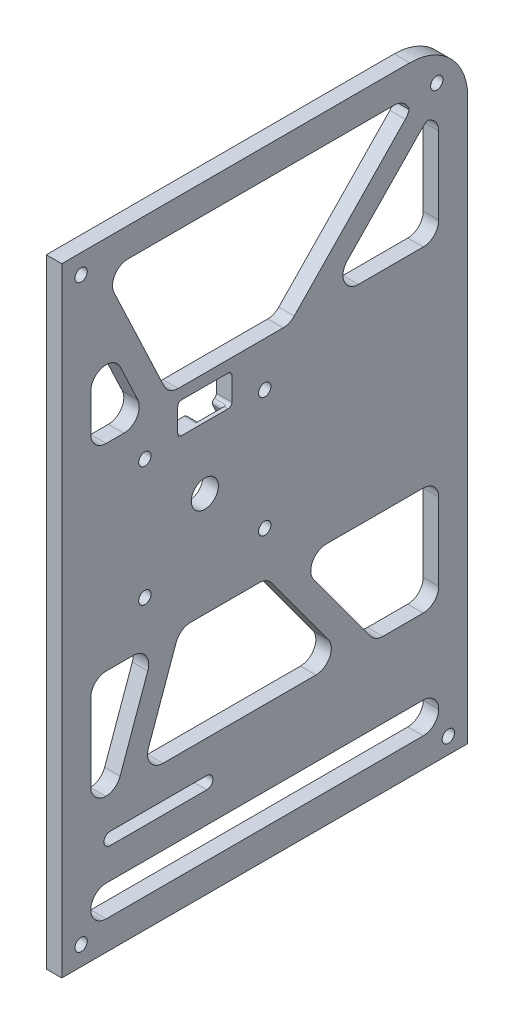
from build123d import *
from OCP.BRepFilletAPI import BRepFilletAPI_MakeChamfer

# Parameters (mm, degrees)
SKETCH2_R           = 1.6
SKETCH2_R_2         = 3.5
SKETCH2_W           = 14
SKETCH2_H           = 8
SKETCH2_W_2         = 90
BOSS_EXTRUDE1_DEPTH = 4
CHAMFER1_SIZE       = 1.5
FILLET2_R           = 1
FILLET3_R           = 4
CUT_EXTRUDE1_DEPTH  = 3
SKETCH4_W           = 5
SKETCH4_H           = 3
BOSS_EXTRUDE2_DEPTH = 1
CHAMFER2_SIZE       = 1.75
CHAMFER2_SIZE2      = 1.010362971
FILLET4_R           = 1


with BuildPart() as part:
    # Sketch2 → Boss-Extrude1 (new body)
    with BuildSketch(Plane(origin=(0, 0, 0), x_dir=(0, 0, -1), z_dir=(1, 0, 0))):
        with BuildLine():
            Line((0, 0), (105, 0))
            Line((105, 0), (105, 145))
            ThreePointArc((105, 145), (100.606601718, 155.606601718), (90, 160))
            Line((90, 160), (0, 160))
            Line((0, 160), (0, 0))
        make_face()
        with Locations((97, 152)):
            Circle(SKETCH2_R, mode=Mode.SUBTRACT)
        with Locations((52.5, 105.5)):
            Circle(SKETCH2_R, mode=Mode.SUBTRACT)
        with Locations((37, 90)):
            Circle(SKETCH2_R_2, mode=Mode.SUBTRACT)
        with Locations((52.5, 74.5)):
            Circle(SKETCH2_R, mode=Mode.SUBTRACT)
        with Locations((21.5, 74.5)):
            Circle(SKETCH2_R, mode=Mode.SUBTRACT)
        with Locations((21.5, 105.5)):
            Circle(SKETCH2_R, mode=Mode.SUBTRACT)
        with Locations((5, 5)):
            Circle(SKETCH2_R, mode=Mode.SUBTRACT)
        with Locations((100, 4.173161374)):
            Circle(SKETCH2_R, mode=Mode.SUBTRACT)
        with Locations((5, 155)):
            Circle(SKETCH2_R, mode=Mode.SUBTRACT)
        Polygon((10.817386923, 152.5), (90, 152.5), (90, 149.080597589), (58.954260398, 117), (27.573386923, 117), align=None, mode=Mode.SUBTRACT)
        with BuildLine():
            Line((12.5, 26.6), (37.5, 26.6))
            ThreePointArc((37.5, 26.6), (39.1, 25), (37.5, 23.4))
            Line((37.5, 23.4), (12.5, 23.4))
            ThreePointArc((12.5, 23.4), (10.9, 25), (12.5, 26.6))
        make_face(mode=Mode.SUBTRACT)
        Polygon((7.5, 35), (7.5, 63), (24.15943135, 63), (14.147310138, 35), align=None, mode=Mode.SUBTRACT)
        Polygon((97.5, 35), (97.5, 63), (60.520215048, 63), (81.053548381, 35), align=None, mode=Mode.SUBTRACT)
        with Locations((37, 110)):
            Rectangle(SKETCH2_W, SKETCH2_H, mode=Mode.SUBTRACT)
        Polygon((7.5, 145.471637874), (7.5, 114), (22.354613077, 114), align=None, mode=Mode.SUBTRACT)
        Polygon((97.5, 145), (97.5, 117), (67.303804118, 117), (94.400578312, 145), align=None, mode=Mode.SUBTRACT)
        with Locations((52.5, 11.5)):
            Rectangle(SKETCH2_W_2, SKETCH2_H, mode=Mode.SUBTRACT)
        Polygon((30.531477741, 63), (20.519356529, 35), (73.613118286, 35), (53.079784952, 63), align=None, mode=Mode.SUBTRACT)
    extrude(amount=BOSS_EXTRUDE1_DEPTH)

    # Chamfer1
    chamfer1_edges = [part.edges().sort_by_distance(p)[0] for p in [
        (0, 74.5, -50.9),
        (0, 105.5, -50.9),
        (0, 74.5, -19.9),
        (0, 105.5, -19.9),
        (0, 155, -3.4),
        (0, 152, -95.4),
        (0, 5, -3.4),
        (0, 4.173161374, -98.4),
    ]]
    chamfer(chamfer1_edges, length=CHAMFER1_SIZE)

    # Fillet2
    fillet2_edges = [part.edges().sort_by_distance(p)[0] for p in [
        (2, 114, -30),
        (2, 106, -30),
        (2, 106, -44),
        (2, 114, -44),
    ]]
    fillet(fillet2_edges, radius=FILLET2_R)

    # Fillet3
    # the kernel refuses this fillet: 4 mm, written as the material it adds along each edge
    with BuildSketch(Plane(origin=(0, 152.5, -90), x_dir=(0, 0, 1), z_dir=(1, 0, 0)), Plane(origin=(0, 117, -97.5), x_dir=(0, 1, 0), z_dir=(1, 0, 0)), Plane(origin=(0, 114, -7.5), x_dir=(0, 0, -1), z_dir=(1, 0, 0)), Plane(origin=(0, 63, -7.5), x_dir=(0, -1, 0), z_dir=(1, 0, 0)), Plane(origin=(0, 63, -97.5), x_dir=(0, 0, 1), z_dir=(1, 0, 0)), Plane(origin=(0, 7.5, -7.5), x_dir=(0, 0, -1), z_dir=(1, 0, 0)), Plane(origin=(0, 15.5, -7.5), x_dir=(0, -1, 0), z_dir=(1, 0, 0)), Plane(origin=(0, 15.5, -97.5), x_dir=(0, 0, 1), z_dir=(1, 0, 0))) as fillet3_piece_1:
        with BuildLine():
            CenterArc((FILLET3_R, FILLET3_R), FILLET3_R, 180, 90)
            Line((0, FILLET3_R), (0, 0))
            Line((0, 0), (FILLET3_R, 0))
        make_face()
    extrude(amount=4)
    with BuildSketch(Plane(origin=(0, 145, -97.5), x_dir=(0, -1, 0), z_dir=(1, 0, 0)), Plane(origin=(0, 35, -7.5), x_dir=(0, 1, 0), z_dir=(1, 0, 0)), Plane(origin=(0, 35, -97.5), x_dir=(0, 0, 1), z_dir=(1, 0, 0)), Plane(origin=(0, 7.5, -97.5), x_dir=(0, 0, 1), z_dir=(1, 0, 0))) as fillet3_piece_2:
        with BuildLine():
            CenterArc((FILLET3_R, -FILLET3_R), FILLET3_R, 90, 90)
            Line((0, -FILLET3_R), (0, 0))
            Line((0, 0), (FILLET3_R, 0))
        make_face()
    extrude(amount=4)
    with BuildSketch(Plane(origin=(0, 117, -67.303804118), x_dir=(0, 0, -1), z_dir=(1, 0, 0))) as fillet3_piece_3:
        with BuildLine():
            CenterArc((FILLET3_R * 2.35933255549, FILLET3_R), FILLET3_R, 135.939190946, 134.060809054)
            Line((FILLET3_R * 1.64073041373, FILLET3_R * 1.69542142752), (0, 0))
            Line((0, 0), (FILLET3_R * 2.35933255549, 0))
        make_face()
    extrude(amount=4)
    with BuildSketch(Plane(origin=(0, 145, -94.400578312), x_dir=(0, -0.7186021417665927, 0.6954214275160536), z_dir=(1, 0, 0)), Plane(origin=(0, 117, -58.954260398), x_dir=(0, 0.7186021417665911, -0.6954214275160554), z_dir=(1, 0, 0))) as fillet3_piece_4:
        with BuildLine():
            CenterArc((FILLET3_R * 0.423848684524, FILLET3_R), FILLET3_R, 224.060809054, 45.939190946)
            Line((-FILLET3_R * 0.294753457243, FILLET3_R * 0.304578572484), (0, 0))
            Line((0, 0), (FILLET3_R * 0.423848684524, 0))
        make_face()
    extrude(amount=4)
    with BuildSketch(Plane(origin=(0, 149.080597589, -90), x_dir=(0, 1, 0), z_dir=(1, 0, 0))) as fillet3_piece_5:
        with BuildLine():
            CenterArc((FILLET3_R * 0.404643640675, FILLET3_R), FILLET3_R, 225.939190946, 44.060809054)
            Line((-FILLET3_R * 0.290777786841, FILLET3_R * 0.281397858233), (0, 0))
            Line((0, 0), (FILLET3_R * 0.404643640675, 0))
        make_face()
    extrude(amount=4)
    with BuildSketch(Plane(origin=(0, 117, -27.573386923), x_dir=(0, 0, -1), z_dir=(1, 0, 0))) as fillet3_piece_6:
        with BuildLine():
            CenterArc((FILLET3_R * 0.633795641156, FILLET3_R), FILLET3_R, 205.2673105, 64.7326895)
            Line((-FILLET3_R * 0.270530585844, FILLET3_R * 0.573158020856), (0, 0))
            Line((0, 0), (FILLET3_R * 0.633795641156, 0))
        make_face()
    extrude(amount=4)
    with BuildSketch(Plane(origin=(0, 145.471637874, -7.5), x_dir=(0, -0.9043262270001705, -0.4268419791440808), z_dir=(1, 0, 0))) as fillet3_piece_7:
        with BuildLine():
            CenterArc((FILLET3_R * 4.46143144313, -FILLET3_R), FILLET3_R, 90, 154.7326895)
            Line((FILLET3_R * 4.03458946398, -FILLET3_R * 1.904326227), (0, 0))
            Line((0, 0), (FILLET3_R * 4.46143144313, 0))
        make_face()
    extrude(amount=4)
    with BuildSketch(Plane(origin=(0, 114, -22.354613077), x_dir=(0, 0.9043262270001708, 0.4268419791440801), z_dir=(1, 0, 0))) as fillet3_piece_8:
        with BuildLine():
            CenterArc((FILLET3_R * 1.57779564116, FILLET3_R), FILLET3_R, 154.7326895, 115.2673105)
            Line((FILLET3_R * 0.673469414156, FILLET3_R * 1.42684197914), (0, 0))
            Line((0, 0), (FILLET3_R * 1.57779564116, 0))
        make_face()
    extrude(amount=4)
    with BuildSketch(Plane(origin=(0, 63, -24.15943135), x_dir=(0, 0, 1), z_dir=(1, 0, 0)), Plane(origin=(0, 35, -20.519356529), x_dir=(0, 0, -1), z_dir=(1, 0, 0))) as fillet3_piece_9:
        with BuildLine():
            CenterArc((FILLET3_R * 1.41958348938, FILLET3_R), FILLET3_R, 160.324181402, 109.675818598)
            Line((FILLET3_R * 0.477970759022, FILLET3_R * 1.3366978854), (0, 0))
            Line((0, 0), (FILLET3_R * 1.41958348938, 0))
        make_face()
    extrude(amount=4)
    with BuildSketch(Plane(origin=(0, 35, -14.147310138), x_dir=(0, 0.9416127303553741, -0.3366978853998008), z_dir=(1, 0, 0))) as fillet3_piece_10:
        with BuildLine():
            CenterArc((FILLET3_R * 0.704431974226, FILLET3_R), FILLET3_R, 199.675818598, 70.324181402)
            Line((-FILLET3_R * 0.23718075613, FILLET3_R * 0.6633021146), (0, 0))
            Line((0, 0), (FILLET3_R * 0.704431974226, 0))
        make_face()
    extrude(amount=4)
    with BuildSketch(Plane(origin=(0, 35, -73.613118286), x_dir=(0, 0.8064049958557061, 0.5913636636275166), z_dir=(1, 0, 0)), Plane(origin=(0, 63, -60.520215048), x_dir=(0, -0.8064049958557059, -0.591363663627517), z_dir=(1, 0, 0))) as fillet3_piece_11:
        with BuildLine():
            CenterArc((FILLET3_R * 1.97340501585, FILLET3_R), FILLET3_R, 143.746162263, 126.253837737)
            Line((FILLET3_R * 1.16700001999, FILLET3_R * 1.59136366363), (0, 0))
            Line((0, 0), (FILLET3_R * 1.97340501585, 0))
        make_face()
    extrude(amount=4)
    with BuildSketch(Plane(origin=(0, 35, -81.053548381), x_dir=(0, 0, -1), z_dir=(1, 0, 0)), Plane(origin=(0, 63, -53.079784952), x_dir=(0, 0, 1), z_dir=(1, 0, 0))) as fillet3_piece_12:
        with BuildLine():
            CenterArc((FILLET3_R * 0.506738349183, FILLET3_R), FILLET3_R, 216.253837737, 53.746162263)
            Line((-FILLET3_R * 0.299666646673, FILLET3_R * 0.408636336372), (0, 0))
            Line((0, 0), (FILLET3_R * 0.506738349183, 0))
        make_face()
    extrude(amount=4)
    with BuildSketch(Plane(origin=(0, 63, -30.531477741), x_dir=(0, 0, -1), z_dir=(1, 0, 0))) as fillet3_piece_13:
        with BuildLine():
            CenterArc((FILLET3_R * 0.704431974226, -FILLET3_R), FILLET3_R, 90, 70.324181402)
            Line((-FILLET3_R * 0.23718075613, -FILLET3_R * 0.6633021146), (0, 0))
            Line((0, 0), (FILLET3_R * 0.704431974226, 0))
        make_face()
    extrude(amount=4)
    with BuildSketch(Plane(origin=(0, 152.5, -10.817386923), x_dir=(0, 0, -1), z_dir=(1, 0, 0))) as fillet3_piece_14:
        with BuildLine():
            CenterArc((FILLET3_R * 1.57779564116, -FILLET3_R), FILLET3_R, 90, 115.2673105)
            Line((FILLET3_R * 0.673469414156, -FILLET3_R * 1.42684197914), (0, 0))
            Line((0, 0), (FILLET3_R * 1.57779564116, 0))
        make_face()
    extrude(amount=4)

    # Sketch3 → Cut-Extrude1 (cut)
    with BuildSketch(Plane.ZY):
        with BuildLine():
            Line((-105, 92.5), (-52.5, 92.5))
            add(Edge.make_bspline(
                [(-52.5, 92.5), (-52.017876095, 92.5), (-51.044765961, 92.531493431), (-49.175773552, 92.725196799), (-46.936261469, 93.222205465), (-44.452218621, 94.253508486), (-42.224067956, 95.723473893), (-40.309183564, 97.599654696), (-38.734147015, 99.826553944), (-37.697483824, 101.940270927), (-37.02420701, 103.764588585), (-36.733100446, 104.736673195), (-36.602852161, 105.221196817)],
                knots=[0, 0, 0, 0, 0.0625, 0.125, 0.25, 0.375, 0.5, 0.625, 0.75, 0.875, 0.9375, 1, 1, 1, 1], degree=3))
            Line((-36.602852161, 105.221196817), (-36.083650039, 107.15262871))
            Line((-36.083650039, 107.15262871), (-41.877945718, 108.710235075))
            Line((-41.877945718, 108.710235075), (-42.397147839, 106.778803183))
            add(Edge.make_bspline(
                [(-52.5, 98.5), (-52.152707996, 98.5), (-51.440728176, 98.52319383), (-50.160426296, 98.657616892), (-48.727404704, 98.980910008), (-47.274023006, 99.590276287), (-46.021815492, 100.417021541), (-44.916524889, 101.494578792), (-43.931651857, 102.874766669), (-43.215740124, 104.322852557), (-42.722217205, 105.655900021), (-42.496646397, 106.408668549), (-42.397147839, 106.778803183)],
                knots=[0, 0, 0, 0, 0.0625, 0.125, 0.25, 0.375, 0.5, 0.625, 0.75, 0.875, 0.9375, 1, 1, 1, 1], degree=3))
            Line((-52.5, 98.5), (-105, 98.5))
            Line((-105, 98.5), (-105, 92.5))
        make_face()
    extrude(amount=-CUT_EXTRUDE1_DEPTH, mode=Mode.SUBTRACT)

    # Sketch4 → Boss-Extrude2 (add)
    with BuildSketch(Plane.ZY):
        with Locations((-80, 97)):
            Rectangle(SKETCH4_W, SKETCH4_H)
        with Locations((-102.5, 94)):
            Rectangle(SKETCH4_W, SKETCH4_H)
        with Locations((-57.5, 94)):
            Rectangle(SKETCH4_W, SKETCH4_H)
    extrude(amount=-BOSS_EXTRUDE2_DEPTH)

    # Chamfer2: one chamfer whose edges measure the first distance from different faces: ONE call of the kernel's chamfer builder (chamfer() names one face for all edges)
    chamfer2_edges_1 = [part.edges().sort_by_distance(p)[0] for p in [
        (1, 98.5, -80),
    ]]
    chamfer2_side_1 = [part.faces().sort_by_distance(p)[0] for p in [
        (1, 97, -80),
    ]]
    chamfer2_edges_2 = [part.edges().sort_by_distance(p)[0] for p in [
        (1, 92.5, -102.5),
    ]]
    chamfer2_side_2 = [part.faces().sort_by_distance(p)[0] for p in [
        (1, 94, -102.5),
    ]]
    chamfer2_edges_3 = [part.edges().sort_by_distance(p)[0] for p in [
        (1, 92.5, -57.5),
    ]]
    chamfer2_side_3 = [part.faces().sort_by_distance(p)[0] for p in [
        (1, 94, -57.5),
    ]]
    chamfer2 = BRepFilletAPI_MakeChamfer(part.part.solid().wrapped)
    for e in chamfer2_edges_1:
        chamfer2.Add(CHAMFER2_SIZE, CHAMFER2_SIZE2, e.wrapped, chamfer2_side_1[0].wrapped)  # the first distance lies on this face
    for e in chamfer2_edges_2:
        chamfer2.Add(CHAMFER2_SIZE, CHAMFER2_SIZE2, e.wrapped, chamfer2_side_2[0].wrapped)  # the first distance lies on this face
    for e in chamfer2_edges_3:
        chamfer2.Add(CHAMFER2_SIZE, CHAMFER2_SIZE2, e.wrapped, chamfer2_side_3[0].wrapped)  # the first distance lies on this face
    add(Compound.cast(chamfer2.Shape()), mode=Mode.REPLACE)

    # Fillet4
    # the kernel refuses this fillet: 1 mm, written as the material it takes off along each edge
    with BuildSketch(Plane(origin=(-2.5, 95.5, -55), x_dir=(0, 0, -1), z_dir=(1, 0, 0))) as fillet4_piece_1_section:
        with BuildLine():
            CenterArc((FILLET4_R, -FILLET4_R), FILLET4_R, 90, 90)
            Line((0, -FILLET4_R), (0, 0))
            Line((0, 0), (FILLET4_R, 0))
        make_face()
    fillet4_piece_1 = extrude(amount=6, mode=Mode.PRIVATE)
    fillet4_piece_1 = split(fillet4_piece_1, bisect_by=Plane(origin=(3, 95.276632061, -55.223367939), z_dir=(-1, 0, 0)), keep=Keep.TOP, mode=Mode.PRIVATE)
    add(fillet4_piece_1, mode=Mode.SUBTRACT)
    with BuildSketch(Plane(origin=(-2.5, 95.5, -100), x_dir=(0, 0, -1), z_dir=(1, 0, 0))) as fillet4_piece_2_section:
        with BuildLine():
            CenterArc((FILLET4_R, -FILLET4_R), FILLET4_R, 90, 90)
            Line((0, -FILLET4_R), (0, 0))
            Line((0, 0), (FILLET4_R, 0))
        make_face()
    fillet4_piece_2 = extrude(amount=6, mode=Mode.PRIVATE)
    fillet4_piece_2 = split(fillet4_piece_2, bisect_by=Plane(origin=(3, 95.276632061, -100.223367939), z_dir=(-1, 0, 0)), keep=Keep.TOP, mode=Mode.PRIVATE)
    add(fillet4_piece_2, mode=Mode.SUBTRACT)
    with BuildSketch(Plane(origin=(-2.5, 95.5, -60), x_dir=(0, -1, 0), z_dir=(1, 0, 0))) as fillet4_piece_3_section:
        with BuildLine():
            CenterArc((FILLET4_R, -FILLET4_R), FILLET4_R, 90, 90)
            Line((0, -FILLET4_R), (0, 0))
            Line((0, 0), (FILLET4_R, 0))
        make_face()
    fillet4_piece_3 = extrude(amount=6, mode=Mode.PRIVATE)
    fillet4_piece_3 = split(fillet4_piece_3, bisect_by=Plane(origin=(3, 95.276632061, -59.776632061), z_dir=(-1, 0, 0)), keep=Keep.TOP, mode=Mode.PRIVATE)
    add(fillet4_piece_3, mode=Mode.SUBTRACT)
    with BuildSketch(Plane(origin=(-2.5, 95.5, -77.5), x_dir=(0, 1, 0), z_dir=(1, 0, 0))) as fillet4_piece_4_section:
        with BuildLine():
            CenterArc((FILLET4_R, -FILLET4_R), FILLET4_R, 90, 90)
            Line((0, -FILLET4_R), (0, 0))
            Line((0, 0), (FILLET4_R, 0))
        make_face()
    fillet4_piece_4 = extrude(amount=6, mode=Mode.PRIVATE)
    fillet4_piece_4 = split(fillet4_piece_4, bisect_by=Plane(origin=(3, 95.723367939, -77.723367939), z_dir=(-1, 0, 0)), keep=Keep.TOP, mode=Mode.PRIVATE)
    add(fillet4_piece_4, mode=Mode.SUBTRACT)
    with BuildSketch(Plane(origin=(-2.5, 95.5, -82.5), x_dir=(0, 0, 1), z_dir=(1, 0, 0))) as fillet4_piece_5_section:
        with BuildLine():
            CenterArc((FILLET4_R, -FILLET4_R), FILLET4_R, 90, 90)
            Line((0, -FILLET4_R), (0, 0))
            Line((0, 0), (FILLET4_R, 0))
        make_face()
    fillet4_piece_5 = extrude(amount=6, mode=Mode.PRIVATE)
    fillet4_piece_5 = split(fillet4_piece_5, bisect_by=Plane(origin=(3, 95.723367939, -82.276632061), z_dir=(-1, 0, 0)), keep=Keep.TOP, mode=Mode.PRIVATE)
    add(fillet4_piece_5, mode=Mode.SUBTRACT)
    with BuildSketch(Plane(origin=(-2.5, 95.5, -105), x_dir=(0, 0, 1), z_dir=(1, 0, 0))) as fillet4_piece_6_section:
        with BuildLine():
            CenterArc((FILLET4_R, FILLET4_R), FILLET4_R, 180, 90)
            Line((0, FILLET4_R), (0, 0))
            Line((0, 0), (FILLET4_R, 0))
        make_face()
    fillet4_piece_6 = extrude(amount=6, mode=Mode.PRIVATE)
    fillet4_piece_6 = split(fillet4_piece_6, bisect_by=Plane(origin=(3, 95.276632061, -104.776632061), z_dir=(-1, 0, 0)), keep=Keep.TOP, mode=Mode.PRIVATE)
    add(fillet4_piece_6, mode=Mode.SUBTRACT)
    with BuildSketch(Plane(origin=(3, 106, -36.393496466), x_dir=(0, -0.9657159464333182, -0.2596010608691742), z_dir=(-1, 0, 0))) as fillet4_piece_7:
        with BuildLine():
            CenterArc((FILLET4_R * 0.766683973549, FILLET4_R), FILLET4_R, 195.046391832, 74.953608168)
            Line((-FILLET4_R * 0.199031972885, FILLET4_R * 0.740398939131), (0, 0))
            Line((0, 0), (FILLET4_R * 0.766683973549, 0))
        make_face()
    extrude(amount=4.916709934, mode=Mode.SUBTRACT)
    with BuildSketch(Plane(origin=(3, 106, -42.623471697), x_dir=(0, 0.13924511253956887, -0.9902579455040201), z_dir=(-1, 0, 0))) as fillet4_piece_8:
        with BuildLine():
            CenterArc((1.206304738, 0.93782822), FILLET4_R, 166.63300314, 83.056972267)
            Line((0.233395532, 1.169015753), (0.136104611, 1.192134506))
            ThreePointArc((0.136104611, 1.192134506), (0.008356469, 0.606067948), (-0.098668102, 0.016266706))
            Line((-0.098668102, 0.016266706), (0.013924511, -0.099025795))
            ThreePointArc((0.013924511, -0.099025795), (0.386784655, -0.046596069), (0.824495023, -0.093782822))
            Line((0.824495023, -0.093782822), (0.859204997, 0))
        make_face()
    extrude(amount=5.980217376, mode=Mode.SUBTRACT)


solid = part.part
